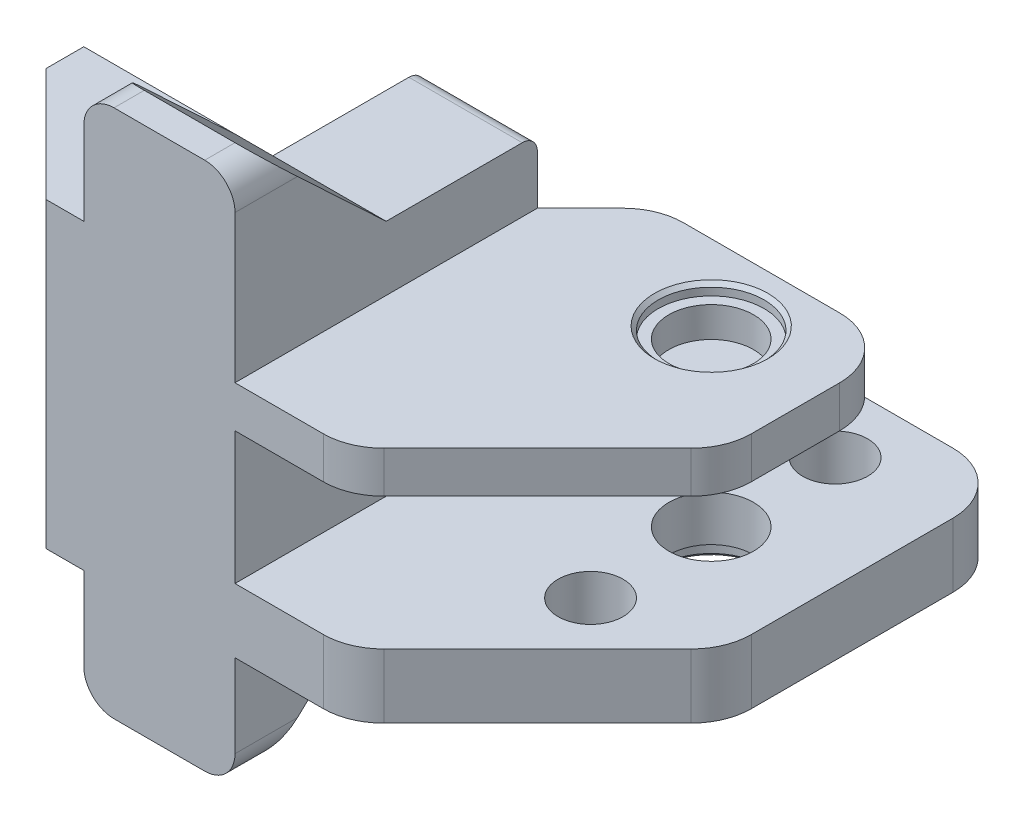
from build123d import *

# Parameters (mm, degrees)
SKETCH1_W                = 40
SKETCH1_H                = 40
BOSS_EXTRUDE1_DEPTH      = 40
SKETCH2_W                = 25
SKETCH2_H                = 20
CUT_EXTRUDE1_DEPTH       = 40
CHAMFER1_SIZE            = 15
CUT_EXTRUDE2_DEPTH       = 15
CHAMFER2_SIZE            = 4
SKETCH4_R                = 2.6
CUT_EXTRUDE3_DEPTH       = 17
BOSS_EXTRUDE2_DEPTH      = 8
BOSS_EXTRUDE2_DEPTH_BACK = 40
SKETCH5_W                = 40
SKETCH5_H                = 8.5
SKETCH5_H_2              = 5.5
SKETCH10_W               = 14
SKETCH10_H               = 10
CUT_EXTRUDE5_DEPTH       = 26
CHAMFER5_SIZE            = 8
SKETCH8_R                = 5.6
CUT_EXTRUDE4_DEPTH       = 34
BOSS_EXTRUDE3_DEPTH      = 20
FILLET3_R                = 4
FILLET4_R                = 2
SKETCH12_R               = 7
CUT_EXTRUDE6_DEPTH       = 1.5
CUT_EXTRUDE7_START       = -2.5
SKETCH13_R               = 7
CUT_EXTRUDE7_DEPTH       = 2.5
CHAMFER7_SIZE            = 25
FILLET6_R                = 8
CHAMFER8_SIZE            = 2
CHAMFER8_SIZE2           = 10
FILLET7_R                = 2
SKETCH14_W               = 40
SKETCH14_H               = 8.5
BOSS_EXTRUDE4_DEPTH      = 15
SKETCH15_R               = 4.3
CUT_EXTRUDE8_DEPTH       = 10
FILLET8_R                = 8
CHAMFER10_SIZE           = 0.5


with BuildPart() as part:
    # Sketch1 → Boss-Extrude1 (new body)
    with BuildSketch(Plane(origin=(0, 0, 0), x_dir=(1, 0, 0), z_dir=(0, 1, 0))):
        with Locations((20, 20)):
            Rectangle(SKETCH1_W, SKETCH1_H)
    extrude(amount=BOSS_EXTRUDE1_DEPTH)

    # Sketch2 → Cut-Extrude1 (cut)
    with BuildSketch(Plane(origin=(0, 40, 0), x_dir=(1, 0, 0), z_dir=(0, 1, 0))):
        with Locations((12.5, 30)):
            Rectangle(SKETCH2_W, SKETCH2_H)
    extrude(amount=-CUT_EXTRUDE1_DEPTH, mode=Mode.SUBTRACT)

    # Chamfer1
    chamfer1_edges = [part.edges().sort_by_distance(p)[0] for p in [
        (0, 20, 0),
    ]]
    chamfer(chamfer1_edges, length=CHAMFER1_SIZE)

    # Sketch3 → Cut-Extrude2 (cut)
    with BuildSketch(Plane.XY):
        Polygon((0, 10), (0, 15), (15, 15), (15, 5), (0, 5), align=None)
        Polygon((0, 30), (0, 25), (15, 25), (15, 35), (0, 35), align=None)
    extrude(amount=-CUT_EXTRUDE2_DEPTH, mode=Mode.SUBTRACT)

    # Chamfer2
    chamfer2_edges = [part.edges().sort_by_distance(p)[0] for p in [
        (15, 35, -7.5),
        (15, 25, -7.5),
        (15, 15, -7.5),
        (15, 5, -7.5),
    ]]
    chamfer(chamfer2_edges, length=CHAMFER2_SIZE)

    # Sketch4 → Cut-Extrude3 (cut)
    with BuildSketch(Plane.XY.offset(-15)):
        with Locations((8, 30)):
            Circle(SKETCH4_R)
        with Locations((8, 10)):
            Circle(SKETCH4_R)
    extrude(amount=-CUT_EXTRUDE3_DEPTH, mode=Mode.SUBTRACT)

    # Sketch5 → Boss-Extrude2 (add, two sides: drawn at the far end of the back side and taken through both)
    with BuildSketch(Plane(origin=(0, 0, -40), x_dir=(-1, 0, 0), z_dir=(0, 0, -1)).offset(-BOSS_EXTRUDE2_DEPTH_BACK)):
        with Locations((-60, 4.25)):
            Rectangle(SKETCH5_W, SKETCH5_H)
        with Locations((-60, 28.75)):
            Rectangle(SKETCH5_W, SKETCH5_H_2)
    extrude(amount=BOSS_EXTRUDE2_DEPTH + BOSS_EXTRUDE2_DEPTH_BACK)

    # Sketch10 → Cut-Extrude5 (cut)
    with BuildSketch(Plane(origin=(40, 0, 0), x_dir=(0, 0, -1), z_dir=(1, 0, 0))):
        with Locations((29, 20)):
            Rectangle(SKETCH10_W, SKETCH10_H)
    extrude(amount=-CUT_EXTRUDE5_DEPTH, mode=Mode.SUBTRACT)

    # Chamfer5
    chamfer5_edges = [part.edges().sort_by_distance(p)[0] for p in [
        (40, 28.75, -48),
    ]]
    chamfer(chamfer5_edges, length=CHAMFER5_SIZE - 0.0001)  # a hair under: the kernel refuses the full size

    # Sketch8 → Cut-Extrude4 (cut)
    with BuildSketch(Plane(origin=(0, 32, 0), x_dir=(1, 0, 0), z_dir=(0, 1, 0))):
        with Locations((65, 38)):
            Circle(SKETCH8_R)
    extrude(amount=-CUT_EXTRUDE4_DEPTH, mode=Mode.SUBTRACT)

    # Sketch9 → Boss-Extrude3 (add)
    with BuildSketch(Plane(origin=(40, 0, 0), x_dir=(0, 0, -1), z_dir=(1, 0, 0))):
        Polygon((0, 40), (0, 55), (4, 55), (20, 40), align=None)
        Polygon((0, 0), (0, -15), (4, -15), (20, 0), align=None)
    extrude(amount=-BOSS_EXTRUDE3_DEPTH)

    # Fillet3
    fillet3_edges = [part.edges().sort_by_distance(p)[0] for p in [
        (20, 55, -2),
        (40, 55, -2),
        (20, -15, -2),
        (40, -15, -2),
    ]]
    fillet(fillet3_edges, radius=FILLET3_R)

    # Fillet4
    fillet4_edges = [part.edges().sort_by_distance(p)[0] for p in [
        (32.5, 40, -40),
        (32.5, 0, -40),
    ]]
    fillet(fillet4_edges, radius=FILLET4_R)

    # Sketch12 → Cut-Extrude6 (cut)
    with BuildSketch(Plane(origin=(0, 31.5, 0), x_dir=(1, 0, 0), z_dir=(0, 1, 0))):
        with Locations(Location((65, 38, 0), (0, 0, 180))):
            Circle(SKETCH12_R)
    extrude(amount=-CUT_EXTRUDE6_DEPTH, mode=Mode.SUBTRACT)

    # Sketch13 → Cut-Extrude7 (cut)
    with BuildSketch(Plane.XZ.offset(CUT_EXTRUDE7_START)):
        with Locations(Location((65, -38, 0), (0, 0, 180))):
            Circle(SKETCH13_R)
    extrude(amount=CUT_EXTRUDE7_DEPTH, mode=Mode.SUBTRACT)

    # Chamfer7
    chamfer7_edges = [part.edges().sort_by_distance(p)[0] for p in [
        (80, 4.25, 0),
        (80, 28.75, 0),
    ]]
    chamfer(chamfer7_edges, length=CHAMFER7_SIZE)

    # Fillet6
    fillet6_edges = [part.edges().sort_by_distance(p)[0] for p in [
        (80, 28.75, -48),
        (47.9999, 28.75, -48),
        (55, 28.75, 0),
        (55, 4.25, 0),
        (80, 4.25, -25),
        (80, 28.75, -25),
    ]]
    fillet(fillet6_edges, radius=FILLET6_R)

    # Chamfer8
    chamfer8_edges = [part.edges().sort_by_distance(p)[0] for p in [
        (40, 20, -36),
    ]]
    chamfer8_side = [part.faces().sort_by_distance(p)[0] for p in [
        (40, 16.5625, -17.75),
    ]]
    chamfer(chamfer8_edges, length=CHAMFER8_SIZE, length2=CHAMFER8_SIZE2, reference=chamfer8_side[0])

    # Fillet7
    fillet7_edges = [part.edges().sort_by_distance(p)[0] for p in [
        (27.5, 15, -36),
        (32.5, 15, -22),
        (32.5, 25, -22),
        (27.5, 25, -36),
        (35, 25, -37),
        (35, 15, -37),
    ]]
    fillet(fillet7_edges, radius=FILLET7_R)

    # Sketch14 → Boss-Extrude4 (add)
    with BuildSketch(Plane(origin=(0, 0, -48), x_dir=(-1, 0, 0), z_dir=(0, 0, -1))):
        with Locations((-60, 4.25)):
            Rectangle(SKETCH14_W, SKETCH14_H)
    extrude(amount=BOSS_EXTRUDE4_DEPTH)

    # Sketch15 → Cut-Extrude8 (cut)
    with BuildSketch(Plane.XZ):
        with Locations(Location((65.260929409, -54.130501699, 0), (0, 0, 270))):
            Circle(SKETCH15_R)
        with Locations(Location((65.16900186, -21.868239994, 0), (0, 0, 270))):
            Circle(SKETCH15_R)
    extrude(amount=-CUT_EXTRUDE8_DEPTH, mode=Mode.SUBTRACT)

    # Fillet8
    fillet8_edges = [part.edges().sort_by_distance(p)[0] for p in [
        (80, 4.25, -63),
        (40, 4.25, -63),
    ]]
    fillet(fillet8_edges, radius=FILLET8_R)

    # Chamfer10
    chamfer10_edges = [part.edges().sort_by_distance(p)[0] for p in [
        (72, 31.5, -38),
        (72, 0, -38),
    ]]
    chamfer(chamfer10_edges, length=CHAMFER10_SIZE)


solid = part.part
